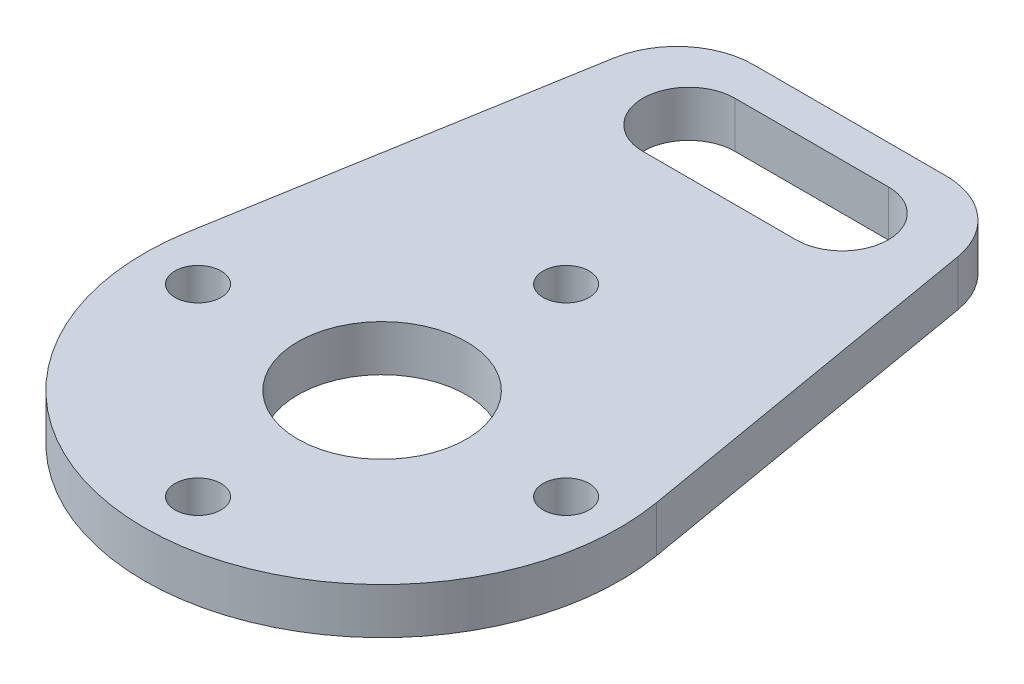
from build123d import *

# Parameters (mm, degrees)
SKETCH1_R                 = 11
SKETCH1_R_2               = 1
BOSS_EXTRUDE1_DEPTH       = 3
F_6_0MM_DOWEL_HOLE1_D     = 6
F_6_0MM_DOWEL_HOLE1_DEPTH = 136
F_6_0MM_DOWEL_HOLE1_TIP   = 1.802581857
FILLET1_R                 = 10


with BuildPart() as part:
    # Sketch1 → Boss-Extrude1 (new, symmetric)
    with BuildSketch(Plane(origin=(0, 0, 0), x_dir=(1, 0, 0), z_dir=(0, 1, 0))):
        with BuildLine():
            Line((-21, 61), (-30.554739738, 5.235253533))
            ThreePointArc((-30.554739738, 5.235253533), (0, -31), (30.554739738, 5.235253533))
            Line((30.554739738, 5.235253533), (21, 61))
            Line((21, 61), (-21, 61))
        make_face()
        Circle(SKETCH1_R, mode=Mode.SUBTRACT)
        with Locations((0, 24)):
            Circle(SKETCH1_R_2, mode=Mode.SUBTRACT)
        with Locations((24, 0)):
            Circle(SKETCH1_R_2, mode=Mode.SUBTRACT)
        with Locations((0, -24)):
            Circle(SKETCH1_R_2, mode=Mode.SUBTRACT)
        with Locations((-24, 0)):
            Circle(SKETCH1_R_2, mode=Mode.SUBTRACT)
        with BuildLine():
            Line((-10, 56), (10, 56))
            ThreePointArc((10, 56), (16, 50), (10, 44))
            Line((10, 44), (-10, 44))
            ThreePointArc((-10, 44), (-16, 50), (-10, 56))
        make_face(mode=Mode.SUBTRACT)
    extrude(amount=BOSS_EXTRUDE1_DEPTH, both=True)

    # Ø6.0mm Dowel Hole1
    with Locations(Plane(origin=(0, 3, 0), x_dir=(1, 0, 0), z_dir=(0, 1, 0))):
        with Locations((0, 24), (24, 0), (0, -24), (-24, 0)):
            Hole(F_6_0MM_DOWEL_HOLE1_D / 2, depth=F_6_0MM_DOWEL_HOLE1_DEPTH)
            with Locations((0, 0, -(F_6_0MM_DOWEL_HOLE1_DEPTH + F_6_0MM_DOWEL_HOLE1_TIP / 2))):  # 118° drill point
                Cone(0, F_6_0MM_DOWEL_HOLE1_D / 2, F_6_0MM_DOWEL_HOLE1_TIP, mode=Mode.SUBTRACT)

    # Fillet1
    fillet1_edges = [part.edges().sort_by_distance(p)[0] for p in [
        (21, 0, -61),
        (-21, 0, -61),
    ]]
    fillet(fillet1_edges, radius=FILLET1_R)


solid = part.part
